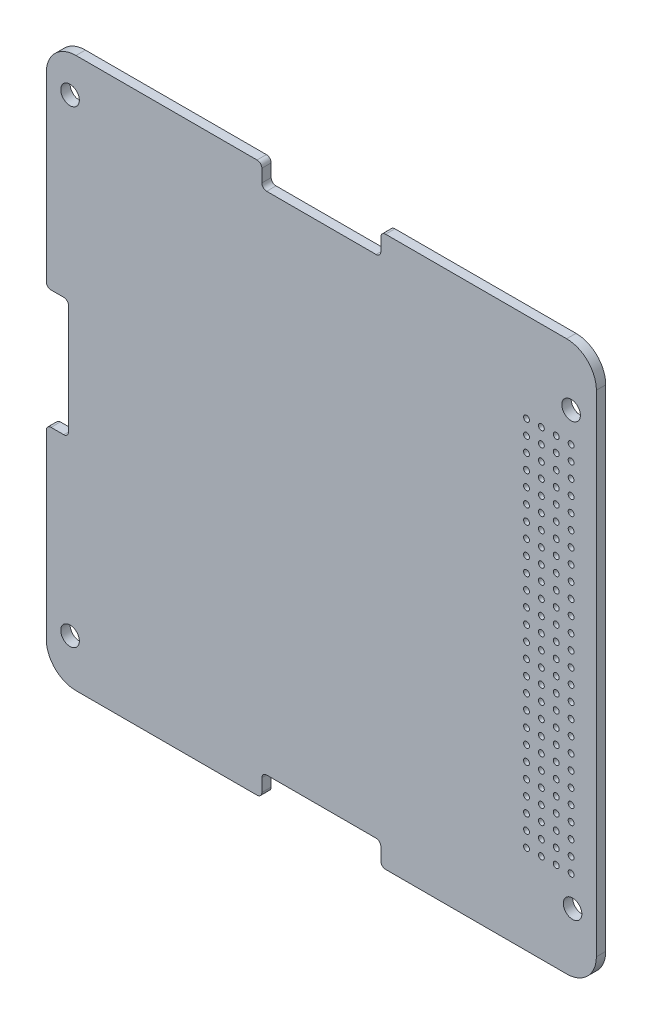
from build123d import *

# Parameters (mm, degrees)
SKETCH1_R           = 0.5
SKETCH1_R_2         = 1.5875
BOSS_EXTRUDE2_DEPTH = 1.6
MOUNTING_HOLES_D    = 3.175


with BuildPart() as part:
    # Sketch1 → Boss-Extrude2 (new body)
    with BuildSketch(Plane.XY):
        with BuildLine():
            Line((5.08, 0), (36.012420783, 0))
            ThreePointArc((36.012420783, 0), (36.590536591, 0.239463409), (36.83, 0.817579217))
            Line((36.83, 0.817579217), (36.83, 2.992420783))
            ThreePointArc((36.83, 2.992420783), (37.069463409, 3.570536591), (37.647579217, 3.81))
            Line((37.647579217, 3.81), (56.332420783, 3.81))
            ThreePointArc((56.332420783, 3.81), (56.910536591, 3.570536591), (57.15, 2.992420783))
            Line((57.15, 2.992420783), (57.15, 0.817579217))
            ThreePointArc((57.15, 0.817579217), (57.389463409, 0.239463409), (57.967579217, 0))
            Line((57.967579217, 0), (88.9, 0))
            ThreePointArc((88.9, 0), (92.492102448, 1.487897552), (93.98, 5.08))
            Line((93.98, 5.08), (93.98, 88.9))
            ThreePointArc((93.98, 88.9), (92.492102448, 92.492102448), (88.9, 93.98))
            Line((88.9, 93.98), (57.967579217, 93.98))
            ThreePointArc((57.967579217, 93.98), (57.389463409, 93.740536591), (57.15, 93.162420783))
            Line((57.15, 93.162420783), (57.15, 90.987579217))
            ThreePointArc((57.15, 90.987579217), (56.910536591, 90.409463409), (56.332420783, 90.17))
            Line((56.332420783, 90.17), (37.647579217, 90.17))
            ThreePointArc((37.647579217, 90.17), (37.069463409, 90.409463409), (36.83, 90.987579217))
            Line((36.83, 90.987579217), (36.83, 93.162420783))
            ThreePointArc((36.83, 93.162420783), (36.590536591, 93.740536591), (36.012420783, 93.98))
            Line((36.012420783, 93.98), (5.08, 93.98))
            ThreePointArc((5.08, 93.98), (1.487897552, 92.492102448), (0, 88.9))
            Line((0, 88.9), (0, 57.967579217))
            ThreePointArc((0, 57.967579217), (0.239463409, 57.389463409), (0.817579217, 57.15))
            Line((0.817579217, 57.15), (2.992420783, 57.15))
            ThreePointArc((2.992420783, 57.15), (3.570536591, 56.910536591), (3.81, 56.332420783))
            Line((3.81, 56.332420783), (3.81, 37.647579217))
            ThreePointArc((3.81, 37.647579217), (3.570536591, 37.069463409), (2.992420783, 36.83))
            Line((2.992420783, 36.83), (0.817579217, 36.83))
            ThreePointArc((0.817579217, 36.83), (0.239463409, 36.590536591), (0, 36.012420783))
            Line((0, 36.012420783), (0, 5.08))
            ThreePointArc((0, 5.08), (1.487897552, 1.487897552), (5.08, 0))
        make_face()
        with Locations((82.042, 78.74)):
            Circle(SKETCH1_R, mode=Mode.SUBTRACT)
        with Locations((84.582, 78.74)):
            Circle(SKETCH1_R, mode=Mode.SUBTRACT)
        with Locations((87.122, 78.74)):
            Circle(SKETCH1_R, mode=Mode.SUBTRACT)
        with Locations((89.662, 78.74)):
            Circle(SKETCH1_R, mode=Mode.SUBTRACT)
        with Locations((84.582, 76.2)):
            Circle(SKETCH1_R, mode=Mode.SUBTRACT)
        with Locations((87.122, 76.2)):
            Circle(SKETCH1_R, mode=Mode.SUBTRACT)
        with Locations((89.662, 76.2)):
            Circle(SKETCH1_R, mode=Mode.SUBTRACT)
        with Locations((84.582, 73.66)):
            Circle(SKETCH1_R, mode=Mode.SUBTRACT)
        with Locations((87.122, 73.66)):
            Circle(SKETCH1_R, mode=Mode.SUBTRACT)
        with Locations((89.662, 73.66)):
            Circle(SKETCH1_R, mode=Mode.SUBTRACT)
        with Locations((84.582, 71.12)):
            Circle(SKETCH1_R, mode=Mode.SUBTRACT)
        with Locations((87.122, 71.12)):
            Circle(SKETCH1_R, mode=Mode.SUBTRACT)
        with Locations((89.662, 71.12)):
            Circle(SKETCH1_R, mode=Mode.SUBTRACT)
        with Locations((84.582, 68.58)):
            Circle(SKETCH1_R, mode=Mode.SUBTRACT)
        with Locations((87.122, 68.58)):
            Circle(SKETCH1_R, mode=Mode.SUBTRACT)
        with Locations((89.662, 68.58)):
            Circle(SKETCH1_R, mode=Mode.SUBTRACT)
        with Locations((84.582, 66.04)):
            Circle(SKETCH1_R, mode=Mode.SUBTRACT)
        with Locations((87.122, 66.04)):
            Circle(SKETCH1_R, mode=Mode.SUBTRACT)
        with Locations((89.662, 66.04)):
            Circle(SKETCH1_R, mode=Mode.SUBTRACT)
        with Locations((84.582, 63.5)):
            Circle(SKETCH1_R, mode=Mode.SUBTRACT)
        with Locations((87.122, 63.5)):
            Circle(SKETCH1_R, mode=Mode.SUBTRACT)
        with Locations((89.662, 63.5)):
            Circle(SKETCH1_R, mode=Mode.SUBTRACT)
        with Locations((84.582, 60.96)):
            Circle(SKETCH1_R, mode=Mode.SUBTRACT)
        with Locations((87.122, 60.96)):
            Circle(SKETCH1_R, mode=Mode.SUBTRACT)
        with Locations((89.662, 60.96)):
            Circle(SKETCH1_R, mode=Mode.SUBTRACT)
        with Locations((84.582, 58.42)):
            Circle(SKETCH1_R, mode=Mode.SUBTRACT)
        with Locations((87.122, 58.42)):
            Circle(SKETCH1_R, mode=Mode.SUBTRACT)
        with Locations((89.662, 58.42)):
            Circle(SKETCH1_R, mode=Mode.SUBTRACT)
        with Locations((84.582, 55.88)):
            Circle(SKETCH1_R, mode=Mode.SUBTRACT)
        with Locations((87.122, 55.88)):
            Circle(SKETCH1_R, mode=Mode.SUBTRACT)
        with Locations((89.662, 55.88)):
            Circle(SKETCH1_R, mode=Mode.SUBTRACT)
        with Locations((84.582, 53.34)):
            Circle(SKETCH1_R, mode=Mode.SUBTRACT)
        with Locations((87.122, 53.34)):
            Circle(SKETCH1_R, mode=Mode.SUBTRACT)
        with Locations((89.662, 53.34)):
            Circle(SKETCH1_R, mode=Mode.SUBTRACT)
        with Locations((84.582, 50.8)):
            Circle(SKETCH1_R, mode=Mode.SUBTRACT)
        with Locations((87.122, 50.8)):
            Circle(SKETCH1_R, mode=Mode.SUBTRACT)
        with Locations((89.662, 50.8)):
            Circle(SKETCH1_R, mode=Mode.SUBTRACT)
        with Locations((84.582, 48.26)):
            Circle(SKETCH1_R, mode=Mode.SUBTRACT)
        with Locations((87.122, 48.26)):
            Circle(SKETCH1_R, mode=Mode.SUBTRACT)
        with Locations((89.662, 48.26)):
            Circle(SKETCH1_R, mode=Mode.SUBTRACT)
        with Locations((84.582, 45.72)):
            Circle(SKETCH1_R, mode=Mode.SUBTRACT)
        with Locations((87.122, 45.72)):
            Circle(SKETCH1_R, mode=Mode.SUBTRACT)
        with Locations((89.662, 45.72)):
            Circle(SKETCH1_R, mode=Mode.SUBTRACT)
        with Locations((84.582, 43.18)):
            Circle(SKETCH1_R, mode=Mode.SUBTRACT)
        with Locations((87.122, 43.18)):
            Circle(SKETCH1_R, mode=Mode.SUBTRACT)
        with Locations((89.662, 43.18)):
            Circle(SKETCH1_R, mode=Mode.SUBTRACT)
        with Locations((84.582, 40.64)):
            Circle(SKETCH1_R, mode=Mode.SUBTRACT)
        with Locations((87.122, 40.64)):
            Circle(SKETCH1_R, mode=Mode.SUBTRACT)
        with Locations((89.662, 40.64)):
            Circle(SKETCH1_R, mode=Mode.SUBTRACT)
        with Locations((84.582, 38.1)):
            Circle(SKETCH1_R, mode=Mode.SUBTRACT)
        with Locations((87.122, 38.1)):
            Circle(SKETCH1_R, mode=Mode.SUBTRACT)
        with Locations((89.662, 38.1)):
            Circle(SKETCH1_R, mode=Mode.SUBTRACT)
        with Locations((84.582, 35.56)):
            Circle(SKETCH1_R, mode=Mode.SUBTRACT)
        with Locations((87.122, 35.56)):
            Circle(SKETCH1_R, mode=Mode.SUBTRACT)
        with Locations((89.662, 35.56)):
            Circle(SKETCH1_R, mode=Mode.SUBTRACT)
        with Locations((84.582, 33.02)):
            Circle(SKETCH1_R, mode=Mode.SUBTRACT)
        with Locations((87.122, 33.02)):
            Circle(SKETCH1_R, mode=Mode.SUBTRACT)
        with Locations((89.662, 33.02)):
            Circle(SKETCH1_R, mode=Mode.SUBTRACT)
        with Locations((84.582, 30.48)):
            Circle(SKETCH1_R, mode=Mode.SUBTRACT)
        with Locations((87.122, 30.48)):
            Circle(SKETCH1_R, mode=Mode.SUBTRACT)
        with Locations((89.662, 30.48)):
            Circle(SKETCH1_R, mode=Mode.SUBTRACT)
        with Locations((84.582, 27.94)):
            Circle(SKETCH1_R, mode=Mode.SUBTRACT)
        with Locations((87.122, 27.94)):
            Circle(SKETCH1_R, mode=Mode.SUBTRACT)
        with Locations((89.662, 27.94)):
            Circle(SKETCH1_R, mode=Mode.SUBTRACT)
        with Locations((84.582, 25.4)):
            Circle(SKETCH1_R, mode=Mode.SUBTRACT)
        with Locations((87.122, 25.4)):
            Circle(SKETCH1_R, mode=Mode.SUBTRACT)
        with Locations((89.662, 25.4)):
            Circle(SKETCH1_R, mode=Mode.SUBTRACT)
        with Locations((84.582, 22.86)):
            Circle(SKETCH1_R, mode=Mode.SUBTRACT)
        with Locations((87.122, 22.86)):
            Circle(SKETCH1_R, mode=Mode.SUBTRACT)
        with Locations((89.662, 22.86)):
            Circle(SKETCH1_R, mode=Mode.SUBTRACT)
        with Locations((84.582, 20.32)):
            Circle(SKETCH1_R, mode=Mode.SUBTRACT)
        with Locations((87.122, 20.32)):
            Circle(SKETCH1_R, mode=Mode.SUBTRACT)
        with Locations((89.662, 20.32)):
            Circle(SKETCH1_R, mode=Mode.SUBTRACT)
        with Locations((84.582, 17.78)):
            Circle(SKETCH1_R, mode=Mode.SUBTRACT)
        with Locations((87.122, 17.78)):
            Circle(SKETCH1_R, mode=Mode.SUBTRACT)
        with Locations((89.662, 17.78)):
            Circle(SKETCH1_R, mode=Mode.SUBTRACT)
        with Locations((84.582, 15.24)):
            Circle(SKETCH1_R, mode=Mode.SUBTRACT)
        with Locations((87.122, 15.24)):
            Circle(SKETCH1_R, mode=Mode.SUBTRACT)
        with Locations((89.662, 15.24)):
            Circle(SKETCH1_R, mode=Mode.SUBTRACT)
        with Locations((82.042, 76.2)):
            Circle(SKETCH1_R, mode=Mode.SUBTRACT)
        with Locations((82.042, 73.66)):
            Circle(SKETCH1_R, mode=Mode.SUBTRACT)
        with Locations((82.042, 71.12)):
            Circle(SKETCH1_R, mode=Mode.SUBTRACT)
        with Locations((82.042, 68.58)):
            Circle(SKETCH1_R, mode=Mode.SUBTRACT)
        with Locations((82.042, 66.04)):
            Circle(SKETCH1_R, mode=Mode.SUBTRACT)
        with Locations((82.042, 63.5)):
            Circle(SKETCH1_R, mode=Mode.SUBTRACT)
        with Locations((82.042, 60.96)):
            Circle(SKETCH1_R, mode=Mode.SUBTRACT)
        with Locations((82.042, 58.42)):
            Circle(SKETCH1_R, mode=Mode.SUBTRACT)
        with Locations((82.042, 55.88)):
            Circle(SKETCH1_R, mode=Mode.SUBTRACT)
        with Locations((82.042, 53.34)):
            Circle(SKETCH1_R, mode=Mode.SUBTRACT)
        with Locations((82.042, 50.8)):
            Circle(SKETCH1_R, mode=Mode.SUBTRACT)
        with Locations((82.042, 48.26)):
            Circle(SKETCH1_R, mode=Mode.SUBTRACT)
        with Locations((82.042, 45.72)):
            Circle(SKETCH1_R, mode=Mode.SUBTRACT)
        with Locations((82.042, 43.18)):
            Circle(SKETCH1_R, mode=Mode.SUBTRACT)
        with Locations((82.042, 40.64)):
            Circle(SKETCH1_R, mode=Mode.SUBTRACT)
        with Locations((82.042, 38.1)):
            Circle(SKETCH1_R, mode=Mode.SUBTRACT)
        with Locations((82.042, 35.56)):
            Circle(SKETCH1_R, mode=Mode.SUBTRACT)
        with Locations((82.042, 33.02)):
            Circle(SKETCH1_R, mode=Mode.SUBTRACT)
        with Locations((82.042, 30.48)):
            Circle(SKETCH1_R, mode=Mode.SUBTRACT)
        with Locations((82.042, 27.94)):
            Circle(SKETCH1_R, mode=Mode.SUBTRACT)
        with Locations((82.042, 25.4)):
            Circle(SKETCH1_R, mode=Mode.SUBTRACT)
        with Locations((82.042, 22.86)):
            Circle(SKETCH1_R, mode=Mode.SUBTRACT)
        with Locations((82.042, 20.32)):
            Circle(SKETCH1_R, mode=Mode.SUBTRACT)
        with Locations((82.042, 17.78)):
            Circle(SKETCH1_R, mode=Mode.SUBTRACT)
        with Locations((82.042, 15.24)):
            Circle(SKETCH1_R, mode=Mode.SUBTRACT)
        with Locations((89.916, 10.16)):
            Circle(SKETCH1_R_2, mode=Mode.SUBTRACT)
        with Locations((89.662, 83.82)):
            Circle(SKETCH1_R_2, mode=Mode.SUBTRACT)
        with Locations((4.064, 7.62)):
            Circle(SKETCH1_R_2, mode=Mode.SUBTRACT)
        with Locations((4.064, 87.63)):
            Circle(SKETCH1_R_2, mode=Mode.SUBTRACT)
    extrude(amount=BOSS_EXTRUDE2_DEPTH)

    # Mounting holes (through all)
    with Locations(Plane(origin=(4.064, 87.63, 1.6), x_dir=(1, 0, 0), z_dir=(0, 0, 1))):
        with Locations((0, 0), (85.598, -3.81), (85.852, -77.47), (0, -80.01)):
            Hole(MOUNTING_HOLES_D / 2)


solid = part.part
